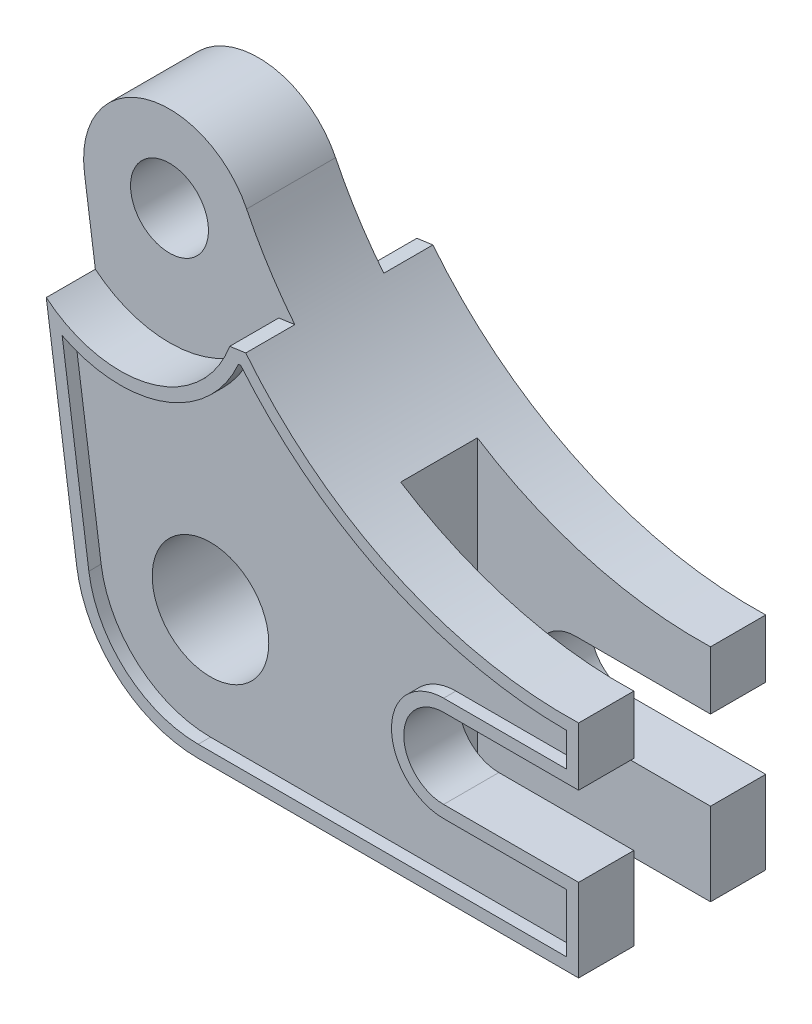
from build123d import *

# Parameters (mm, degrees)
SKETCH1_R               = 9.5
BOSS_EXTRUDE1_DEPTH     = 13.25
SKETCH1_3_R             = 6.35
BOSS_EXTRUDE2_DEPTH     = 7.25
CUT_EXTRUDE1_DEPTH      = 6.25
CUT_EXTRUDE1_DEPTH_BACK = 6.25
BOSS_EXTRUDE3_START     = 2
BOSS_EXTRUDE3_DEPTH     = 2


with BuildPart() as part:
    # Sketch1 → Boss-Extrude1 (new, symmetric)
    with BuildSketch(Plane.XY):
        with BuildLine():
            Line((0, -20), (62, -20))
            Line((62, -20), (62, -6.5))
            Line((62, -6.5), (40, -6.5))
            ThreePointArc((40, -6.5), (33.5, 0), (40, 6.5))
            Line((40, 6.5), (62, 6.5))
            Line((62, 6.5), (62, 16))
            ThreePointArc((62, 16), (31.919908552, 22.165377002), (7.749025136, 41.101907044))
            Line((7.749025136, 41.101907044), (5.136930943, 40.736356639))
            ThreePointArc((5.136930943, 40.736356639), (-7.733145917, 28.986224059), (-24.7667399, 32.668773448))
            Line((-24.7667399, 32.668773448), (-19.806983567, -2.771895014))
            ThreePointArc((-19.806983567, -2.771895014), (-13.125587601, -15.09035951), (0, -20))
        make_face()
        Circle(SKETCH1_R, mode=Mode.SUBTRACT)
    extrude(amount=BOSS_EXTRUDE1_DEPTH, both=True)

    # Sketch1<3> → Boss-Extrude2 (add, symmetric)
    with BuildSketch(Plane.XY):
        with BuildLine():
            Line((-26.547021707, 45.390038979), (-24.7667399, 32.668773448))
            ThreePointArc((-24.7667399, 32.668773448), (-7.733145917, 28.986224059), (5.136930943, 40.736356639))
            Line((5.136930943, 40.736356639), (7.749025136, 41.101907044))
            ThreePointArc((7.749025136, 41.101907044), (3.479246225, 47.080483998), (-0.110282709, 53.49060696))
            ThreePointArc((-0.110282709, 53.49060696), (-16.78369233, 60.716074763), (-26.547021707, 45.390038979))
        make_face()
        with Locations((-12.68213321, 47.330365488)):
            Circle(SKETCH1_3_R, mode=Mode.SUBTRACT)
    extrude(amount=BOSS_EXTRUDE2_DEPTH, both=True)

    # Sketch2 → Cut-Extrude1 (cut, two sides: drawn at the far end of the back side and taken through both)
    with BuildSketch(Plane.XY.offset(-CUT_EXTRUDE1_DEPTH_BACK)):
        with BuildLine():
            Line((24, 26.500204749), (24, -20))
            Line((24, -20), (62, -20))
            Line((62, -20), (62, -6.5))
            Line((62, -6.5), (40, -6.5))
            ThreePointArc((40, -6.5), (33.5, 0), (40, 6.5))
            Line((40, 6.5), (62, 6.5))
            Line((62, 6.5), (62, 16))
            ThreePointArc((62, 16), (42.210208125, 18.391863706), (24, 26.500204749))
        make_face()
    extrude(amount=CUT_EXTRUDE1_DEPTH + CUT_EXTRUDE1_DEPTH_BACK, mode=Mode.SUBTRACT)

    # Sketch3 → Boss-Extrude3 (add)
    with BuildSketch(Plane.XY.offset(13.25).offset(BOSS_EXTRUDE3_START)):
        with BuildLine():
            ThreePointArc((62, 16), (31.919908552, 22.165377002), (7.749025136, 41.101907044))
            Line((7.749025136, 41.101907044), (5.136930943, 40.736356639))
            ThreePointArc((5.136930943, 40.736356639), (-7.733145917, 28.986224059), (-24.7667399, 32.668773448))
            Line((-24.7667399, 32.668773448), (-19.806983567, -2.771895014))
            ThreePointArc((-19.806983567, -2.771895014), (-13.125587601, -15.09035951), (0, -20))
            Line((0, -20), (62, -20))
            Line((62, -20), (62, -6.5))
            Line((62, -6.5), (40, -6.5))
            ThreePointArc((40, -6.5), (33.5, 0), (40, 6.5))
            Line((40, 6.5), (62, 6.5))
            Line((62, 6.5), (62, 16))
        make_face()
        with BuildLine():
            Line((6.558313722, 38.915782797), (6.909885355, 38.964983608))
            ThreePointArc((6.909885355, 38.964983608), (30.665749587, 20.54362907), (60, 13.971784495))
            Line((60, 13.971784495), (60, 8.5))
            Line((60, 8.5), (40, 8.5))
            ThreePointArc((40, 8.5), (31.5, 0), (40, -8.5))
            Line((40, -8.5), (60, -8.5))
            Line((60, -8.5), (60, -18))
            Line((60, -18), (0, -18))
            ThreePointArc((0, -18), (-11.813028841, -13.581323559), (-17.826285211, -2.494705512))
            Line((-17.826285211, -2.494705512), (-22.177824667, 28.599859789))
            ThreePointArc((-22.177824667, 28.599859789), (-5.586738105, 27.565361863), (6.558313722, 38.915782797))
        make_face(mode=Mode.SUBTRACT)
    extrude(amount=-BOSS_EXTRUDE3_DEPTH)

    # Mirror1: part across plane


with BuildPart() as part_1:
    add(part.part)
    add(part.part.mirror(Plane.XY))


solid = part_1.part
